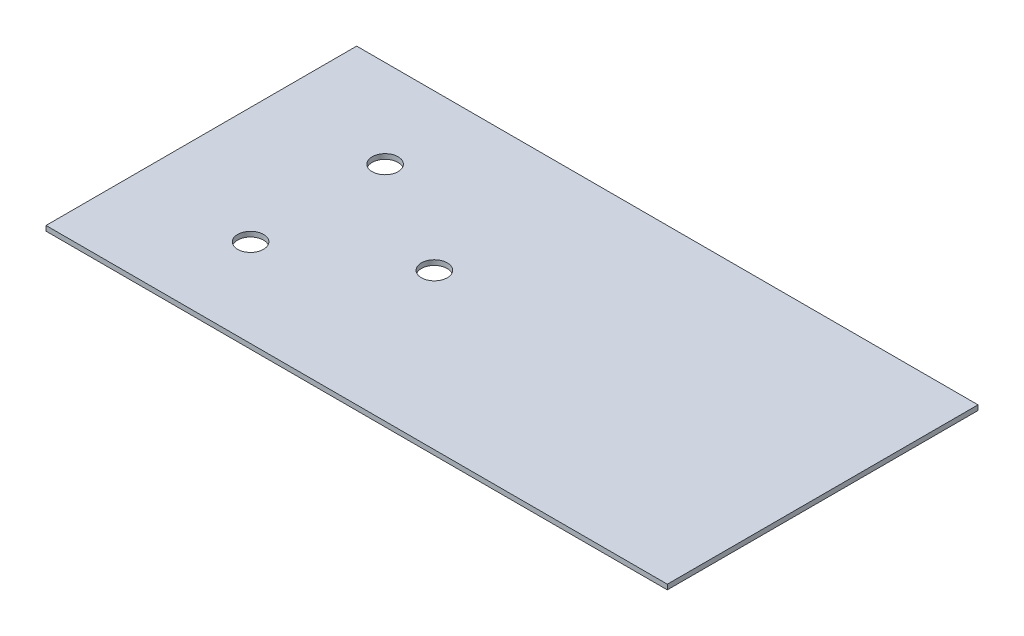
from build123d import *

# Parameters (mm, degrees)
SKETCH2_W                   = 152.4
SKETCH2_H                   = 76.2
BASE_FLANGE1_DEPTH          = 1.2192
F_1_4_0_25_DIAMETER_HOLE1_D = 6.35
CIRPATTERN1_COUNT           = 3


# Sheet-metal steps are written as plain solids
with BuildPart() as part:
    # Sketch2 → Base-Flange1 (new body)
    with BuildSketch(Plane(origin=(0, 0, 0), x_dir=(1, 0, 0), z_dir=(0, 1, 0))):
        with Locations((76.2, 38.1)):
            Rectangle(SKETCH2_W, SKETCH2_H)
    extrude(amount=BASE_FLANGE1_DEPTH)

    # 1/4 (0.25) Diameter Hole1 (through all)
    with Locations(Plane(origin=(57.15, 1.2192, -38.1), x_dir=(0, 0, 1), z_dir=(0, 1, 0))):
        with Locations((0, 0)):
            f_1_4_0_25_diameter_hole1 = Hole(F_1_4_0_25_DIAMETER_HOLE1_D / 2)

    # CirPattern1: 1/4 (0.25) Diameter Hole1 ×3 about axis
    cirpattern1_axis = Axis((38.1, 0, -38.1), (0, 1, 0))
    for i in range(1, CIRPATTERN1_COUNT):
        add(f_1_4_0_25_diameter_hole1.rotate(cirpattern1_axis, i * 360 / CIRPATTERN1_COUNT), mode=Mode.SUBTRACT)


solid = part.part
